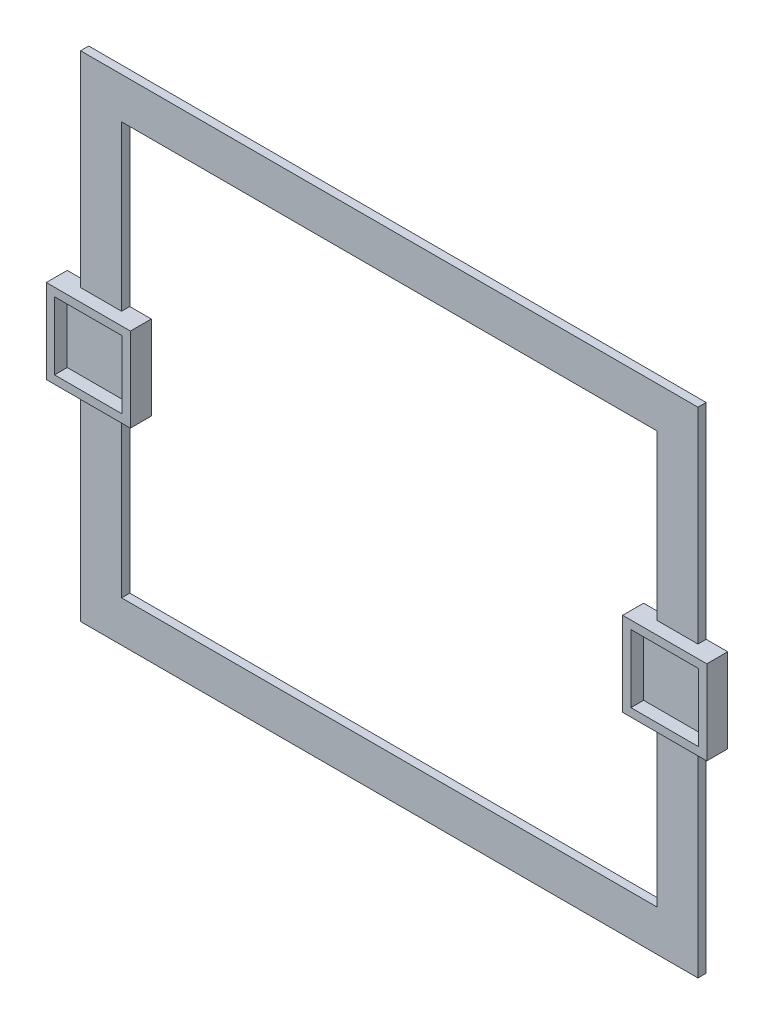
from build123d import *

# Parameters (mm, degrees)
SKETCH1_W             = 52.07
SKETCH1_H             = 52.07
SKETCH1_W_2           = 41.91
SKETCH1_H_2           = 41.91
BOSS_EXTRUDE1_DEPTH   = 7.874
BOSS_EXTRUDE1_2_DEPTH = 7.874
BOSS_EXTRUDE3_DEPTH   = 5.08
BOSS_EXTRUDE3_2_DEPTH = 5.08
SKETCH3_W             = 52.07
SKETCH3_H             = 52.07
BOSS_EXTRUDE4_DEPTH   = 5.08


with BuildPart() as part:
    # Sketch1 → Boss-Extrude1 (new body)
    with BuildSketch(Plane.XY):
        with Locations((20.955, 20.955)):
            Rectangle(SKETCH1_W, SKETCH1_H)
        with Locations((20.955, 20.955)):
            Rectangle(SKETCH1_W_2, SKETCH1_H_2, mode=Mode.SUBTRACT)
    extrude(amount=BOSS_EXTRUDE1_DEPTH)



with BuildPart() as body_2:
    # Sketch1 → Boss-Extrude1 2 (new body)
    with BuildSketch(Plane.XY):
        with Locations((377.825, 20.955)):
            Rectangle(SKETCH1_W, SKETCH1_H)
        with Locations((377.825, 20.955)):
            Rectangle(SKETCH1_W_2, SKETCH1_H_2, mode=Mode.SUBTRACT)
    extrude(amount=BOSS_EXTRUDE1_2_DEPTH)


with BuildPart() as body_3:
    # Sketch2 → Boss-Extrude3 (new body)
    with BuildSketch(Plane(origin=(0, 0, 0), x_dir=(-1, 0, 0), z_dir=(0, 0, -1))):
        Polygon((-8.255, -132.08), (-8.255, -5.08), (-33.655, -5.08), (-33.655, -106.68), (-365.125, -106.68), (-365.125, -5.08), (-390.525, -5.08), (-390.525, -132.08), align=None)
    extrude(amount=BOSS_EXTRUDE3_DEPTH)


with BuildPart() as body_4:
    # Sketch2 → Boss-Extrude3 2 (new body)
    with BuildSketch(Plane(origin=(0, 0, 0), x_dir=(-1, 0, 0), z_dir=(0, 0, -1))):
        Polygon((-33.655, 46.99), (-8.255, 46.99), (-8.255, 173.99), (-390.525, 173.99), (-390.525, 46.99), (-365.125, 46.99), (-365.125, 148.59), (-33.655, 148.59), align=None)
    extrude(amount=BOSS_EXTRUDE3_2_DEPTH)


with BuildPart() as part_1:
    add(part.part)

    add(body_2.part)  # Boss-Extrude4 merges body 2

    add(body_3.part)  # Boss-Extrude4 merges body 3

    add(body_4.part)  # Boss-Extrude4 merges body 4
    # Sketch3 → Boss-Extrude4 (add)
    with BuildSketch(Plane(origin=(0, 0, 0), x_dir=(-1, 0, 0), z_dir=(0, 0, -1))):
        with Locations((-20.955, 20.955)):
            Rectangle(SKETCH3_W, SKETCH3_H)
        with Locations((-377.825, 20.955)):
            Rectangle(SKETCH3_W, SKETCH3_H)
    extrude(amount=BOSS_EXTRUDE4_DEPTH)


solid = part_1.part
